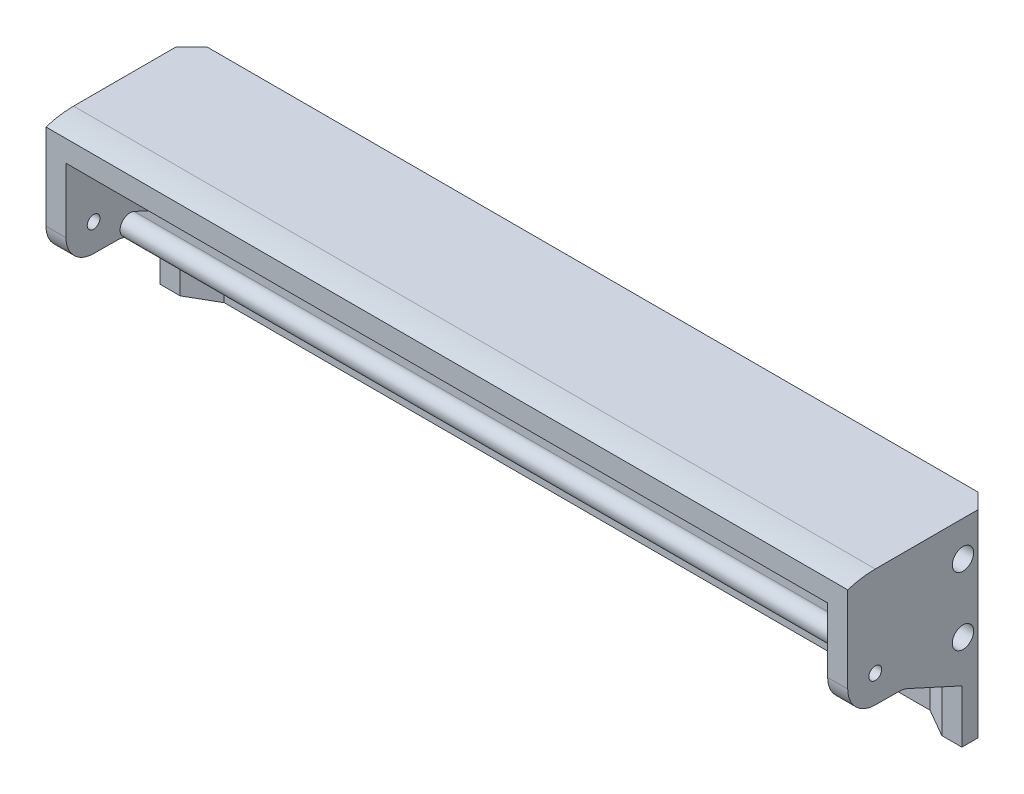
from build123d import *

# Parameters (mm, degrees)
SKETCH1_R           = 3.3782
SKETCH1_R_2         = 2.0193
BOSS_EXTRUDE1_DEPTH = 6.35
BOSS_EXTRUDE2_START = 120.65
BOSS_EXTRUDE2_DEPTH = 120.65
BOSS_EXTRUDE3_REACH = 145.827
CHAMFER1_SIZE       = 4.826


with BuildPart() as part:
    # Sketch1 → Boss-Extrude1 (new body)
    with BuildSketch(Plane(origin=(0, 0, 0), x_dir=(0, 0, -1), z_dir=(1, 0, 0))):
        with BuildLine():
            ThreePointArc((17.267409525, 39.723483692), (18.59285001, 39.573142424), (19.857637877, 39.149224239))
            Line((19.857637877, 39.149224239), (42.164, 28.956))
            Line((42.164, 28.956), (42.164, 14.4653))
            Line((42.164, 14.4653), (46.99, 14.4653))
            Line((46.99, 14.4653), (46.99, 77.089))
            Line((46.99, 77.089), (9.62025, 77.089))
            ThreePointArc((9.62025, 77.089), (5.201472483, 76.745277517), (0.889, 75.722379195))
            Line((0.889, 75.722379195), (0.889, 48.514))
            ThreePointArc((0.889, 48.514), (3.422551022, 42.363938704), (9.552880645, 39.783009911))
            Line((9.552880645, 39.783009911), (17.267409525, 39.723483692))
        make_face()
        with Locations((37.4015, 44.4881)):
            Circle(SKETCH1_R, mode=Mode.SUBTRACT)
        with Locations((9.62025, 48.514)):
            Circle(SKETCH1_R_2, mode=Mode.SUBTRACT)
        with Locations((37.4015, 65.9765)):
            Circle(SKETCH1_R, mode=Mode.SUBTRACT)
    extrude(amount=-BOSS_EXTRUDE1_DEPTH)

    # Sketch2 → Boss-Extrude2 (add)
    with BuildSketch(Plane(origin=(0, 0, 0), x_dir=(0, 0, -1), z_dir=(1, 0, 0)).offset(BOSS_EXTRUDE2_START)):
        with BuildLine():
            Line((42.164, 35.93758433), (22.496862123, 44.924775761))
            ThreePointArc((22.496862123, 44.924775761), (18.289474239, 43.356612123), (19.857637877, 39.149224239))
            Line((19.857637877, 39.149224239), (42.164, 28.956))
            Line((42.164, 28.956), (42.164, 14.4653))
            Line((42.164, 14.4653), (46.99, 14.4653))
            Line((46.99, 14.4653), (46.99, 77.089))
            Line((46.99, 77.089), (9.62025, 77.089))
            ThreePointArc((9.62025, 77.089), (5.201472483, 76.745277517), (0.889, 75.722379195))
            Line((0.889, 75.722379195), (0.889, 68.952099188))
            ThreePointArc((0.889, 68.952099188), (5.164137875, 70.287692607), (9.62025, 70.739))
            Line((9.62025, 70.739), (42.164, 70.739))
            Line((42.164, 70.739), (42.164, 35.93758433))
        make_face()
    extrude(amount=-BOSS_EXTRUDE2_DEPTH)

    # Boss-Extrude3: up to this plane
    boss_extrude3_end = Plane(origin=(-6.35, 39.893111336, -18.2297511), z_dir=(0, -0.909535672675175, 0.41562586557060793))
    # Sketch5 → Boss-Extrude3 (add, up to the surface)
    with BuildSketch(Plane.XZ.offset(-14.4653), mode=Mode.PRIVATE) as boss_extrude3_sk1:
        Polygon((8.841135647, -42.164), (6.8e-08, -37.059567994), (-6.35, -37.059567994), (-6.35, -42.164), align=None)
    boss_extrude3_tool1 = split(extrude(boss_extrude3_sk1.sketch, amount=-BOSS_EXTRUDE3_REACH, mode=Mode.PRIVATE), bisect_by=boss_extrude3_end, keep=Keep.BOTH, mode=Mode.PRIVATE)
    add(boss_extrude3_tool1.solids().sort_by_distance((-0.662327, 14.4653, -39.960953))[0])

    # Mirror1: part across plane


with BuildPart() as part_1:
    add(part.part)
    add(part.part.mirror(Plane(origin=(120.65, 0, 0), x_dir=(0, 0, 1), z_dir=(1, 0, 0))))

    # Chamfer1
    chamfer1_edges = [part_1.edges().sort_by_distance(p)[0] for p in [
        (247.65, 45.77715, -46.99),
        (-6.35, 45.77715, -46.99),
    ]]
    chamfer(chamfer1_edges, length=CHAMFER1_SIZE)


solid = part_1.part
